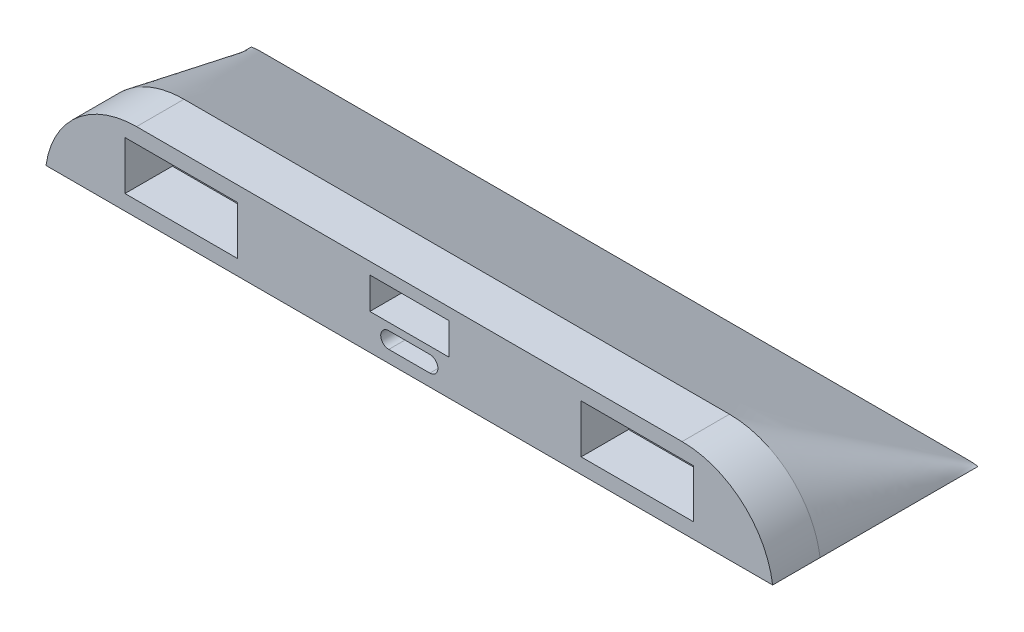
from build123d import *

# Parameters (mm, degrees)
BOSS_EXTRUDE1_DEPTH = 76.2
SKETCH2_W           = 180.9496
SKETCH2_H           = 78.03134
SKETCH2_W_2         = 127
SKETCH2_H_2         = 50.8
CUT_EXTRUDE1_DEPTH  = 76.2


with BuildPart() as part:
    # Sketch1 → Boss-Extrude1 (new body)
    with BuildSketch(Plane.XY):
        with BuildLine():
            Line((-584.2, 0), (584.2, 0))
            ThreePointArc((584.2, 0), (535.188258209, 90.789887512), (438.576756504, 127))
            Line((438.576756504, 127), (-438.576756504, 127))
            ThreePointArc((-438.576756504, 127), (-535.188258209, 90.789887512), (-584.2, 0))
        make_face()
    extrude(amount=-BOSS_EXTRUDE1_DEPTH)

    # Loft1: read off the stored shape, not the designer's step
    # Loft1: loft between two sections, ruled curve by curve
    loft1_from = [
        Edge.make_bspline([(-584.2, 0, -76.2), (-583.602677072, 4.351664449, -76.2), (-581.94853293, 13.529720202, -76.2), (-577.585189912, 28.763596798, -76.2), (-571.896855427, 42.457531156, -76.2), (-565.960173951, 53.561084536, -76.2), (-560.857691344, 61.771321412, -76.2), (-555.178341071, 69.68396559, -76.2), (-549.059386104, 77.11664178, -76.2), (-542.65384448, 83.942924223, -76.2), (-536.11353113, 90.091918429, -76.2), (-529.567640938, 95.550501886, -76.2), (-520.952426768, 101.945292478, -76.2), (-510.573870375, 108.405393128, -76.2), (-498.976829365, 114.201455922, -76.2), (-488.256849582, 118.493217251, -76.2), (-480.009359128, 121.10578275, -76.2), (-473.782446896, 122.747805575, -76.2), (-469.287755099, 123.779296572, -76.2), (-464.958507992, 124.634750113, -76.2), (-460.78541139, 125.332114872, -76.2), (-456.759171111, 125.889339521, -76.2), (-452.871694762, 126.319936535, -76.2), (-449.114889951, 126.637418388, -76.2), (-445.481735397, 126.852172344, -76.2), (-442.551297416, 126.954183445, -76.2), (-440.548392688, 126.988713545, -76.2), (-439.417330042, 126.998411604, -76.2), (-438.85622104, 127, -76.2), (-356.853622112, 127, -76.2), (-208.360858153, 127, -76.2), (0, 127, -76.2), (208.360858153, 127, -76.2), (356.853622112, 127, -76.2), (439.135685576, 127, -76.2), (440.262263441, 126.993646416, -76.2), (442.551297416, 126.954183445, -76.2), (445.481735397, 126.852172344, -76.2), (449.114889951, 126.637418388, -76.2), (452.871694762, 126.319936535, -76.2), (456.759171111, 125.889339521, -76.2), (460.78541139, 125.332114872, -76.2), (464.958507992, 124.634750113, -76.2), (469.287755099, 123.779296572, -76.2), (473.782446896, 122.747805575, -76.2), (480.009359128, 121.10578275, -76.2), (488.256849582, 118.493217251, -76.2), (498.976829365, 114.201455922, -76.2), (510.573870375, 108.405393128, -76.2), (520.952426768, 101.945292478, -76.2), (529.567640938, 95.550501886, -76.2), (536.11353113, 90.091918429, -76.2), (542.65384448, 83.942924223, -76.2), (549.059386104, 77.11664178, -76.2), (555.178341071, 69.68396559, -76.2), (560.857691344, 61.771321412, -76.2), (565.960173951, 53.561084536, -76.2), (571.896855427, 42.457531156, -76.2), (577.585189912, 28.763596798, -76.2), (581.94853293, 13.529720202, -76.2), (583.602677072, 4.351664449, -76.2), (584.2, 0, -76.2)], [0, 0, 0, 0, 0.005611238, 0.011222477, 0.016833715, 0.019639334, 0.022444953, 0.025250572, 0.028056191, 0.030861811, 0.03366743, 0.036473049, 0.039278668, 0.044889906, 0.050501145, 0.056112383, 0.061723621, 0.06452924, 0.067334859, 0.070140479, 0.072946098, 0.075751717, 0.078557336, 0.081362955, 0.084168574, 0.086974193, 0.088377003, 0.089078408, 0.089779813, 0.089779813, 0.294889906, 0.5, 0.705110094, 0.910220187, 0.910220187, 0.911622997, 0.913025807, 0.915831426, 0.918637045, 0.921442664, 0.924248283, 0.927053902, 0.929859521, 0.932665141, 0.93547076, 0.938276379, 0.943887617, 0.949498855, 0.955110094, 0.960721332, 0.963526951, 0.96633257, 0.969138189, 0.971943809, 0.974749428, 0.977555047, 0.980360666, 0.983166285, 0.988777523, 0.994388762, 1, 1, 1, 1], 3),
        Edge.make_line((584.2, 0, -76.2), (-584.2, 0, -76.2)),
    ]
    loft1_to = [
        Edge.make_bspline([(-584.2, 0, -330.2), (-583.878101952, 0.052800057, -330.2), (-583.267715844, 0.149611396, -330.2), (-582.414749369, 0.276891548, -330.2), (-581.738860454, 0.371753895, -330.2), (-581.211959231, 0.442392619, -330.2), (-580.82242239, 0.492983874, -330.2), (-580.437258746, 0.541425131, -330.2), (-580.055424309, 0.587888921, -330.2), (-579.67587509, 0.632547776, -330.2), (-579.297704023, 0.675524661, -330.2), (-578.920004041, 0.716942542, -330.2), (-578.415843138, 0.770211673, -330.2), (-577.782360828, 0.833365434, -330.2), (-577.009420934, 0.904209016, -330.2), (-576.214803468, 0.970521194, -330.2), (-575.525235405, 1.022243227, -330.2), (-574.948991796, 1.061577806, -330.2), (-574.501645168, 1.0900619, -330.2), (-574.035409855, 1.11752563, -330.2), (-573.545736133, 1.143951944, -330.2), (-573.025065946, 1.169298466, -330.2), (-572.464378068, 1.193502556, -330.2), (-571.844640219, 1.216425807, -330.2), (-571.139468768, 1.237858047, -330.2), (-570.417752062, 1.254008948, -330.2), (-569.756604739, 1.263783908, -330.2), (-569.226630089, 1.26820891, -330.2), (-568.907435621, 1.27, -330.2), (-482.014175175, 1.27, -330.2), (-298.281328262, 1.27, -330.2), (0, 1.27, -330.2), (298.281328262, 1.27, -330.2), (482.014175175, 1.27, -330.2), (569.203567514, 1.27, -330.2), (569.588743756, 1.264710472, -330.2), (570.459224282, 1.254274384, -330.2), (571.114690237, 1.237699455, -330.2), (571.857968498, 1.216511112, -330.2), (572.456964688, 1.193455108, -330.2), (573.029183058, 1.169324817, -330.2), (573.5434696, 1.143937438, -330.2), (574.036638767, 1.117533495, -330.2), (574.501004172, 1.090057797, -330.2), (574.949284923, 1.061579682, -330.2), (575.525034183, 1.022241939, -330.2), (576.21492146, 0.970521949, -330.2), (577.00936018, 0.904208627, -330.2), (577.78239323, 0.833365642, -330.2), (578.415834076, 0.770211615, -330.2), (578.919999998, 0.716942516, -330.2), (579.297708191, 0.675524688, -330.2), (579.675877264, 0.63254779, -330.2), (580.055422099, 0.587888907, -330.2), (580.437257579, 0.541425124, -330.2), (580.822423551, 0.492983882, -330.2), (581.211959859, 0.442392623, -330.2), (581.738859448, 0.371753888, -330.2), (582.41475001, 0.276891552, -330.2), (583.267715502, 0.149611394, -330.2), (583.878101952, 0.052800057, -330.2), (584.2, 0, -330.2)], [0, 0, 0, 0, 0.005611238, 0.011222477, 0.016833715, 0.019639334, 0.022444953, 0.025250572, 0.028056191, 0.030861811, 0.03366743, 0.036473049, 0.039278668, 0.044889906, 0.050501145, 0.056112383, 0.061723621, 0.06452924, 0.067334859, 0.070140479, 0.072946098, 0.075751717, 0.078557336, 0.081362955, 0.084168574, 0.086974193, 0.088377003, 0.089078408, 0.089779813, 0.089779813, 0.294889906, 0.5, 0.705110094, 0.910220187, 0.910220187, 0.911622997, 0.913025807, 0.915831426, 0.918637045, 0.921442664, 0.924248283, 0.927053902, 0.929859521, 0.932665141, 0.93547076, 0.938276379, 0.943887617, 0.949498855, 0.955110094, 0.960721332, 0.963526951, 0.96633257, 0.969138189, 0.971943809, 0.974749428, 0.977555047, 0.980360666, 0.983166285, 0.988777523, 0.994388762, 1, 1, 1, 1], 3),
        Edge.make_line((584.2, 0, -330.2), (-584.2, 0, -330.2)),
    ]
    loft1 = Solid(Shell([*[Face.make_surface_from_curves(loft1_from[k], loft1_to[k]) for k in range(2)], Face(Wire(loft1_from)), Face(Wire(loft1_to))]))
    add(loft1)

    # Sketch2 → Cut-Extrude1 (cut)
    with BuildSketch(Plane.XY):
        with Locations((-366.7252, 63.5)):
            Rectangle(SKETCH2_W, SKETCH2_H)
        with Locations((366.7252, 63.5)):
            Rectangle(SKETCH2_W, SKETCH2_H)
        with BuildLine():
            Line((-33, 45.558), (33, 45.558))
            ThreePointArc((33, 45.558), (46, 32.558), (33, 19.558))
            Line((33, 19.558), (-33, 19.558))
            ThreePointArc((-33, 19.558), (-46, 32.558), (-33, 45.558))
        make_face()
        with Locations((0, 82.55)):
            Rectangle(SKETCH2_W_2, SKETCH2_H_2)
    extrude(amount=-CUT_EXTRUDE1_DEPTH, mode=Mode.SUBTRACT)


solid = part.part
